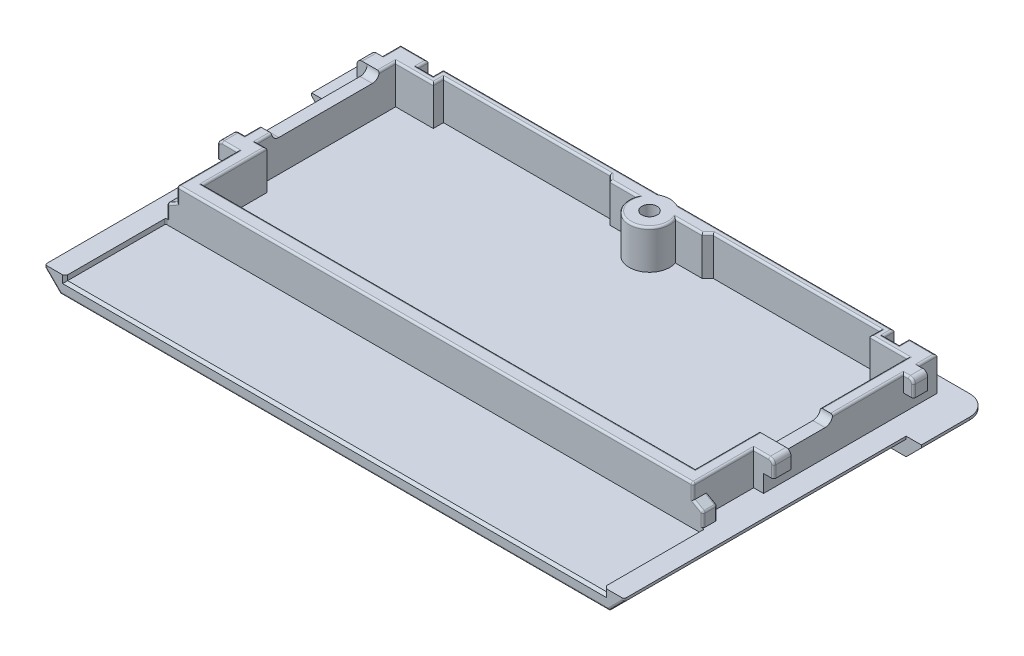
from build123d import *
from build123d.topology import SkipClean

# Parameters (mm, degrees)
BOSS_EXTRUDE1_DEPTH = 5.1
CUT_EXTRUDE17_START = -3.34
CUT_EXTRUDE17_DEPTH = 3.34
CUT_EXTRUDE18_DEPTH = 0.5
CUT_EXTRUDE19_START = -0.5
CUT_EXTRUDE19_DEPTH = 0.5
SKETCH34_W          = 1
SKETCH34_H          = 1.7
CUT_EXTRUDE25_DEPTH = 36.690790129
CUT_EXTRUDE26_DEPTH = 1.4
CUT_EXTRUDE27_DEPTH = 1.2
CUT_EXTRUDE28_DEPTH = 1.2
SKETCH33_R          = 0.75
CUT_EXTRUDE24_DEPTH = 4.6
CHAMFER6_SIZE       = 1.5
FILLET2_R           = 0.2
FILLET3_R           = 0.5
FILLET5_R           = 0.2
CHAMFER3_SIZE       = 0.25
CUT_EXTRUDE29_DEPTH = 0.26
CHAMFER7_SIZE       = 1


with BuildPart() as part:
    # Sketch1 → Boss-Extrude1 (new body)
    with BuildSketch(Plane(origin=(0, 0, 0), x_dir=(1, 0, 0), z_dir=(0, 1, 0))):
        with BuildLine():
            Line((28, 17.25), (0, 17.25))
            Line((0, 17.25), (0, -17.25))
            Line((0, -17.25), (28.5, -17.25))
            Line((28.5, -17.25), (28.5, 10.5))
            Line((28.5, 10.5), (30, 10.5))
            Line((30, 10.5), (30, 15.25))
            ThreePointArc((30, 15.25), (29.414213562, 16.664213562), (28, 17.25))
        make_face()
    boss_extrude1 = extrude(amount=BOSS_EXTRUDE1_DEPTH)

    # Sketch22 → Cut-Extrude17 (cut)
    with BuildSketch(Plane(origin=(0, 5.1, 0), x_dir=(1, 0, 0), z_dir=(0, 1, 0)).offset(CUT_EXTRUDE17_START)):
        with BuildLine():
            Line((0, 11.75), (0, -5.95))
            Line((0, -5.95), (24.2, -5.95))
            Line((24.2, -5.95), (24.2, 0.3))
            Line((24.2, 0.3), (25.175, 0.3))
            Line((25.175, 0.3), (25.175, 13.95))
            Line((25.175, 13.95), (21.475, 13.95))
            Line((21.475, 13.95), (21.475, 14.95))
            Line((21.475, 14.95), (5.075, 14.95))
            Line((5.075, 14.95), (4.525, 14.4))
            Line((4.525, 14.4), (1.891428032, 14.4))
            ThreePointArc((1.891428032, 14.4), (1.62788206, 12.588104996), (0, 11.75))
        make_face()
        with BuildLine():
            Line((0, 17.25), (0, 15.75))
            ThreePointArc((0, 15.75), (0.316227766, 15.724841766), (0.6244998, 15.65))
            Line((0.6244998, 15.65), (22.175, 15.65))
            Line((22.175, 15.65), (22.175, 14.65))
            Line((22.175, 14.65), (23.675, 14.65))
            Line((23.675, 14.65), (23.675, 15.65))
            Line((23.675, 15.65), (26.375, 15.65))
            Line((26.375, 15.65), (26.375, 13.75))
            Line((26.375, 13.75), (27.375, 13.75))
            Line((27.375, 13.75), (27.375, 12.35))
            Line((27.375, 12.35), (26.375, 12.35))
            Line((26.375, 12.35), (26.375, 0.3))
            Line((26.375, 0.3), (27.375, 0.3))
            Line((27.375, 0.3), (27.375, -1.4))
            Line((27.375, -1.4), (25.4, -1.4))
            Line((25.4, -1.4), (25.4, -5.95))
            Line((25.4, -5.95), (26.375, -5.95))
            Line((26.375, -5.95), (26.375, -7.35))
            Line((26.375, -7.35), (0, -7.35))
            Line((0, -7.35), (0, -17.25))
            Line((0, -17.25), (28.5, -17.25))
            Line((28.5, -17.25), (28.5, 10.5))
            Line((28.5, 10.5), (30, 10.5))
            Line((30, 10.5), (30, 15.25))
            ThreePointArc((30, 15.25), (29.414213562, 16.664213562), (28, 17.25))
            Line((28, 17.25), (0, 17.25))
        make_face()
    cut_extrude17 = extrude(amount=CUT_EXTRUDE17_DEPTH, mode=Mode.SUBTRACT)

    # Sketch23 → Cut-Extrude18 (cut)
    with BuildSketch(Plane(origin=(0, 1.76, 0), x_dir=(1, 0, 0), z_dir=(0, 1, 0))):
        with BuildLine():
            Line((0, -7.35), (26.375, -7.35))
            ThreePointArc((26.375, -7.35), (26.463388348, -7.386611652), (26.5, -7.475))
            Line((26.5, -7.475), (26.5, -17.25))
            Line((26.5, -17.25), (0, -17.25))
            Line((0, -17.25), (0, -7.35))
        make_face()
    cut_extrude18 = extrude(amount=-CUT_EXTRUDE18_DEPTH, mode=Mode.SUBTRACT)

    # Sketch25 → Cut-Extrude19 (cut)
    with BuildSketch(Plane(origin=(0, 1.76, 0), x_dir=(1, 0, 0), z_dir=(0, 1, 0)).offset(CUT_EXTRUDE19_START)):
        with BuildLine():
            Line((0, 11.75), (0, -5.95))
            Line((0, -5.95), (24.2, -5.95))
            Line((24.2, -5.95), (24.2, 0.3))
            Line((24.2, 0.3), (25.175, 0.3))
            Line((25.175, 0.3), (25.175, 13.95))
            Line((25.175, 13.95), (21.475, 13.95))
            Line((21.475, 13.95), (21.475, 14.95))
            Line((21.475, 14.95), (5.075, 14.95))
            Line((5.075, 14.95), (4.525, 14.4))
            Line((4.525, 14.4), (1.891428032, 14.4))
            ThreePointArc((1.891428032, 14.4), (1.62788206, 12.588104996), (0, 11.75))
        make_face()
    cut_extrude19 = extrude(amount=CUT_EXTRUDE19_DEPTH, mode=Mode.SUBTRACT)

    # Sketch34 → Cut-Extrude25 (cut, through all)
    with BuildSketch(Plane.XY.offset(1.4)):
        with Locations((26.875, 2.61)):
            Rectangle(SKETCH34_W, SKETCH34_H)
    cut_extrude25 = extrude(amount=-CUT_EXTRUDE25_DEPTH, mode=Mode.SUBTRACT)

    # Sketch35 → Cut-Extrude26 (cut)
    with BuildSketch(Plane.XY.offset(7.35)):
        Polygon((25.4, 5.1), (25.4, 3.65), (26.375, 3.087083488), (26.375, 5.1), align=None)
    cut_extrude26 = extrude(amount=-CUT_EXTRUDE26_DEPTH, mode=Mode.SUBTRACT)


with BuildPart() as mirror10_1:
    # Mirror10: Boss-Extrude1 across plane
    add(boss_extrude1.mirror(Plane(origin=(0, 0, 0), x_dir=(0, 0, 1), z_dir=(1, 0, 0))))

    # Mirror10 2: Cut-Extrude17, Cut-Extrude18, Cut-Extrude19, Cut-Extrude25, Cut-Extrude26 across plane
    add(cut_extrude17.mirror(Plane(origin=(0, 0, 0), x_dir=(0, 0, 1), z_dir=(1, 0, 0))), mode=Mode.SUBTRACT)
    add(cut_extrude18.mirror(Plane(origin=(0, 0, 0), x_dir=(0, 0, 1), z_dir=(1, 0, 0))), mode=Mode.SUBTRACT)
    add(cut_extrude19.mirror(Plane(origin=(0, 0, 0), x_dir=(0, 0, 1), z_dir=(1, 0, 0))), mode=Mode.SUBTRACT)
    add(cut_extrude25.mirror(Plane(origin=(0, 0, 0), x_dir=(0, 0, 1), z_dir=(1, 0, 0))), mode=Mode.SUBTRACT)
    add(cut_extrude26.mirror(Plane(origin=(0, 0, 0), x_dir=(0, 0, 1), z_dir=(1, 0, 0))), mode=Mode.SUBTRACT)


with BuildPart() as part_1:
    add(part.part)

    # Mirror10 united with what the copies tou: union Mirror10_1
    add(mirror10_1.part)

    # Sketch36 → Cut-Extrude27 (cut)
    with SkipClean():  # the faces are left unmerged after this step: merging them gives an invalid solid
        with BuildSketch(Plane(origin=(26.375, 0, 0), x_dir=(0, 0, -1), z_dir=(1, 0, 0))):
            with BuildLine():
                Line((1.05, 4.35), (4.65, 4.35))
                ThreePointArc((4.65, 4.35), (5.4, 5.1), (4.65, 5.85))
                Line((4.65, 5.85), (1.05, 5.85))
                ThreePointArc((1.05, 5.85), (0.3, 5.1), (1.05, 4.35))
            make_face()
        extrude(amount=-CUT_EXTRUDE27_DEPTH, mode=Mode.SUBTRACT)

    # Sketch37 → Cut-Extrude28 (cut)
    with SkipClean():  # the faces are left unmerged after this step: merging them gives an invalid solid
        with BuildSketch(Plane.ZY.offset(26.375)):
            with BuildLine():
                Line((-11.65, 5.8), (-2.45, 5.8))
                ThreePointArc((-2.45, 5.8), (-1.75, 5.1), (-2.45, 4.4))
                Line((-2.45, 4.4), (-11.65, 4.4))
                ThreePointArc((-11.65, 4.4), (-12.35, 5.1), (-11.65, 5.8))
            make_face()
        extrude(amount=-CUT_EXTRUDE28_DEPTH, mode=Mode.SUBTRACT)

    # Sketch33 → Cut-Extrude24 (cut)
    with SkipClean():  # the faces are left unmerged after this step: merging them gives an invalid solid
        with BuildSketch(Plane(origin=(0, 5.1, 0), x_dir=(1, 0, 0), z_dir=(0, 1, 0))):
            with Locations(Location((0, 13.75, 0), (0, 0, 270))):
                Circle(SKETCH33_R)
        extrude(amount=-CUT_EXTRUDE24_DEPTH, mode=Mode.SUBTRACT)

    # Chamfer6
    chamfer6_edges = [part_1.edges().sort_by_distance(p)[0] for p in [
        (29.414213562, 0, -16.664213562),
        (-29.414213562, 0, -16.664213562),
        (-28.5, 0, 3.375),
        (-30, 0, -12.875),
        (30, 0, -12.875),
        (28.5, 0, 3.375),
        (14, 0, -17.25),
    ]]
    chamfer(chamfer6_edges, length=CHAMFER6_SIZE)

    # Fillet2
    fillet2_edges = [part_1.edges().sort_by_distance(p)[0] for p in [
        (25.4, 4.375, 7.35),
        (25.8875, 3.368541744, 7.35),
        (25.8875, 3.368541744, 5.95),
        (26.375, 3.087083488, 6.65),
        (-28.5, 1.63, 17.25),
        (-26.375, 2.423541744, 5.95),
        (-26.375, 2.423541744, 7.35),
        (28.5, 1.63, 17.25),
        (-25.4, 4.375, 7.35),
        (-25.8875, 3.368541744, 7.35),
        (-26.375, 3.087083488, 6.65),
        (-25.8875, 3.368541744, 5.95),
        (13.5, 0, 17.25),
        (27.75, 0.75, 17.25),
        (-27.75, 0.75, 17.25),
        (26.375, 2.423541744, 7.35),
        (26.375, 2.423541744, 5.95),
    ]]
    fillet(fillet2_edges, radius=FILLET2_R)

    # Fillet3
    fillet3_edges = [part_1.edges().sort_by_distance(p)[0] for p in [
        (-27.375, 5.1, -13.05),
        (-27.375, 5.1, 0.55),
        (27.375, 5.1, 0.55),
        (27.375, 5.1, -13.05),
    ]]
    fillet(fillet3_edges, radius=FILLET3_R)

    # Fillet5
    fillet5_edges = [part_1.edges().sort_by_distance(p)[0] for p in [
        (26.1375, 5.1, 1.4),
        (27.228553391, 4.953553391, 1.4),
        (27.375, 4.03, 1.4),
        (25.4, 5.1, 4.275),
        (25.341421356, 5.1, 7.291421356),
        (12.6, 5.1, 7.35),
        (24.2, 5.1, 2.825),
        (12.1, 5.1, 5.95),
        (26.375, 5.1, -8.875),
        (26.375, 5.1, -14.7),
        (-26.1375, 5.1, 1.4),
        (-25.4, 5.1, 4.275),
        (-26.625, 5.1, -0.3),
        (-25.341421356, 5.1, 7.291421356),
        (-26.375, 5.1, -1.025),
        (-12.6, 5.1, 7.35),
        (-25.175, 5.1, -1.025),
        (-12.1, 5.1, 5.95),
        (-24.6875, 5.1, -0.3),
        (-24.2, 5.1, 2.825),
        (11.3997499, 5.1, -15.65),
        (22.175, 5.1, -15.15),
        (22.925, 5.1, -14.65),
        (25.025, 5.1, -15.65),
        (23.675, 5.1, -15.15),
        (26.625, 5.1, -12.35),
        (25.175, 5.1, -9.675),
        (23.325, 5.1, -13.95),
        (21.475, 5.1, -14.45),
        (13.275, 5.1, -14.95),
        (4.8, 5.1, -14.675),
        (3.208214016, 5.1, -14.4),
        (1.62788206, 5.1, -12.588104996),
        (27.228553391, 4.953553391, -12.35),
        (27.375, 4.03, -12.35),
        (-27.228553391, 4.953553391, 1.4),
        (-27.375, 4.03, 1.4),
        (-27.228553391, 4.953553391, -0.3),
        (-27.375, 4.03, -0.3),
        (-26.375, 5.1, -14.7),
        (-25.175, 5.1, -13.15),
        (-11.3997499, 5.1, -15.65),
        (-22.175, 5.1, -15.15),
        (-22.925, 5.1, -14.65),
        (-25.025, 5.1, -15.65),
        (-23.675, 5.1, -15.15),
        (-23.325, 5.1, -13.95),
        (-21.475, 5.1, -14.45),
        (-13.275, 5.1, -14.95),
        (-4.8, 5.1, -14.675),
        (-3.208214016, 5.1, -14.4),
        (-1.62788206, 5.1, -12.588104996),
    ]]
    fillet(fillet5_edges, radius=FILLET5_R)

    # Chamfer3
    chamfer3_edges = [part_1.edges().sort_by_distance(p)[0] for p in [
        (13.25, 1.26, 17.25),
        (26.5, 1.51, 17.25),
        (-26.5, 1.51, 17.25),
    ]]
    chamfer(chamfer3_edges, length=CHAMFER3_SIZE)

    # Sketch38 → Cut-Extrude29 (cut)
    with SkipClean():  # the faces are left unmerged after this step: merging them gives an invalid solid
        with BuildSketch(Plane.XZ):
            with BuildLine():
                Line((22.60392665, -11.5), (-22.60392665, -11.5))
                ThreePointArc((-22.60392665, -11.5), (0, -15.25), (22.60392665, -11.5))
            make_face()
        extrude(amount=-CUT_EXTRUDE29_DEPTH, mode=Mode.SUBTRACT)

    # Chamfer7
    # the kernel refuses this chamfer: 1 mm, written as the material it adds along each edge
    with BuildSketch(Plane(origin=(25.175609638, 0.26, -11.5), x_dir=(0, -0.9996219169112968, 0.027495876610585623), z_dir=(-1, 0, 0))) as chamfer7_piece_1_section:
        Polygon((CHAMFER7_SIZE * 0.999621916911, -CHAMFER7_SIZE * 0.0274958766106), (-CHAMFER7_SIZE * 0.0274958766106, -CHAMFER7_SIZE * 0.999621916911), (0, 0), align=None)
    chamfer7_piece_1 = extrude(amount=50.351219276, mode=Mode.PRIVATE)
    chamfer7_piece_1 = split(chamfer7_piece_1, bisect_by=Plane(origin=(23.111518423, 0, -12.004917919), z_dir=(0, 1, 0)), keep=Keep.TOP, mode=Mode.PRIVATE)
    add(chamfer7_piece_1)
    with BuildSketch(Plane(origin=(0, 0.26, 54.75), x_dir=(-0.35746014134752013, 0, -0.9339283951930207), z_dir=(-0.9339283951930207, 0, 0.35746014134752013))) as chamfer7_piece_2_section:
        Polygon((70, CHAMFER7_SIZE), (70 - CHAMFER7_SIZE, 0), (70, 0), align=None)
    chamfer7_piece_2 = revolve(axis=Axis((0, 0.26, 54.75), (0, -1, 0)), revolution_arc=41.888592603, mode=Mode.PRIVATE)
    chamfer7_piece_2 = split(chamfer7_piece_2, bisect_by=Plane(origin=(-22.914995781, 0, -10.846942197), z_dir=(0, 1, 0)), keep=Keep.TOP, mode=Mode.PRIVATE)
    add(chamfer7_piece_2)


solid = part_1.part
